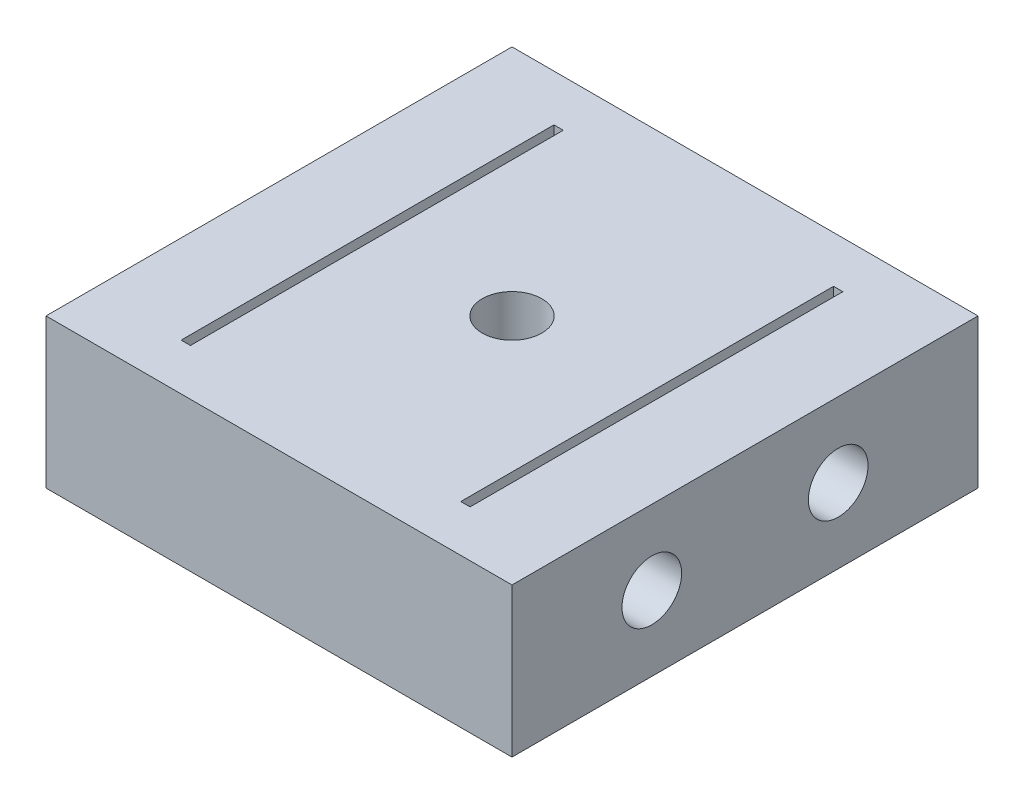
from build123d import *

# Parameters (mm, degrees)
SKETCH2_W           = 25
SKETCH2_H           = 25
SKETCH2_R           = 1.6
SKETCH2_W_2         = 0.5
SKETCH2_H_2         = 20
BOSS_EXTRUDE1_DEPTH = 8
SKETCH3_R           = 1.6
CUT_EXTRUDE1_DEPTH  = 37.249137921


with BuildPart() as part:
    # Sketch2 → Boss-Extrude1 (new body)
    with BuildSketch(Plane(origin=(0, 0, 0), x_dir=(1, 0, 0), z_dir=(0, 1, 0))):
        with Locations((12.5, 12.5)):
            Rectangle(SKETCH2_W, SKETCH2_H)
        with Locations((12.5, 12.5)):
            Circle(SKETCH2_R, mode=Mode.SUBTRACT)
        with Locations((5, 12.5)):
            Rectangle(SKETCH2_W_2, SKETCH2_H_2, mode=Mode.SUBTRACT)
        with Locations((20, 12.5)):
            Rectangle(SKETCH2_W_2, SKETCH2_H_2, mode=Mode.SUBTRACT)
    extrude(amount=BOSS_EXTRUDE1_DEPTH)

    # Sketch3 → Cut-Extrude1 (cut, through all)
    with BuildSketch(Plane(origin=(25, 0, 0), x_dir=(0, 0, -1), z_dir=(1, 0, 0))):
        with Locations((7.5, 4)):
            Circle(SKETCH3_R)
        with Locations((17.5, 4)):
            Circle(SKETCH3_R)
    extrude(amount=-CUT_EXTRUDE1_DEPTH, mode=Mode.SUBTRACT)


solid = part.part
